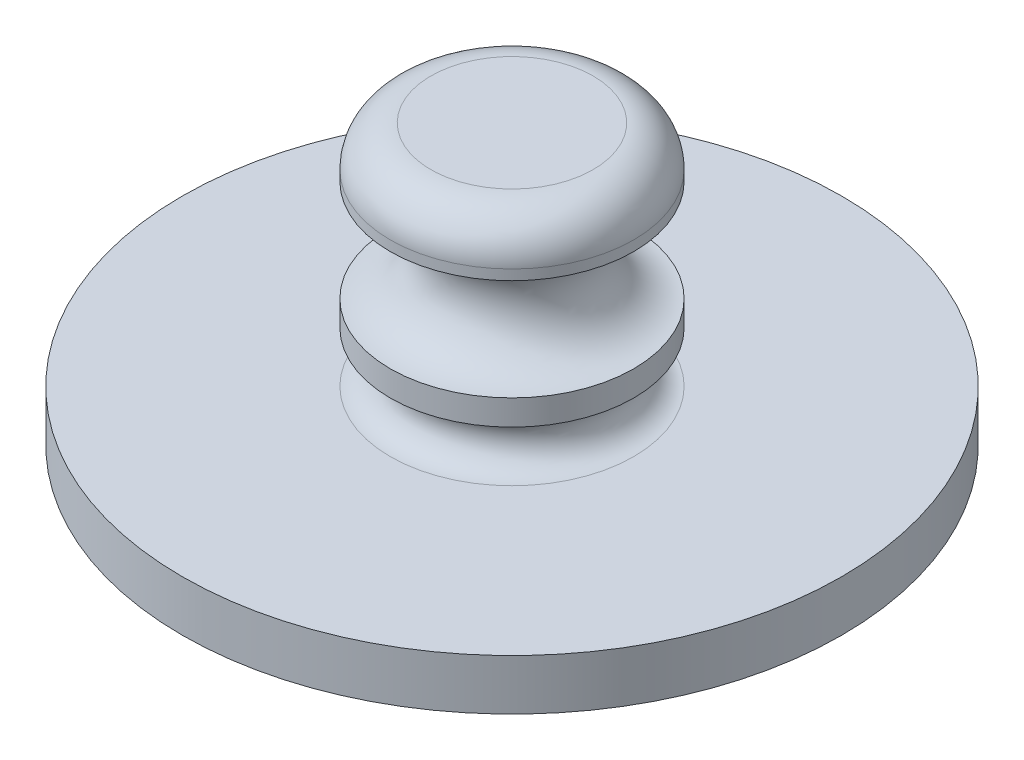
from build123d import *


with BuildPart() as part:
    # Sketch1 → Revolve1 (revolve)
    with BuildSketch(Plane.XY):
        with BuildLine():
            Line((0, 1), (0, 0))
            Line((0, 0), (6.5, 0))
            Line((6.5, 0), (6.5, 1))
            Line((6.5, 1), (2.4, 1))
            ThreePointArc((2.4, 1), (1.9, 1.5), (2.4, 2))
            Line((2.4, 2), (2.4, 2.5))
            ThreePointArc((2.4, 2.5), (1.4, 3.5), (2.4, 4.5))
            Line((2.4, 4.5), (2.4, 4.7))
            ThreePointArc((2.4, 4.7), (2.165685425, 5.265685425), (1.6, 5.5))
            Line((1.6, 5.5), (0, 5.5))
            Line((0, 5.5), (0, 1))
        make_face()
    revolve(axis=Axis((0, 0, 0), (0, 1, 0)))


solid = part.part
